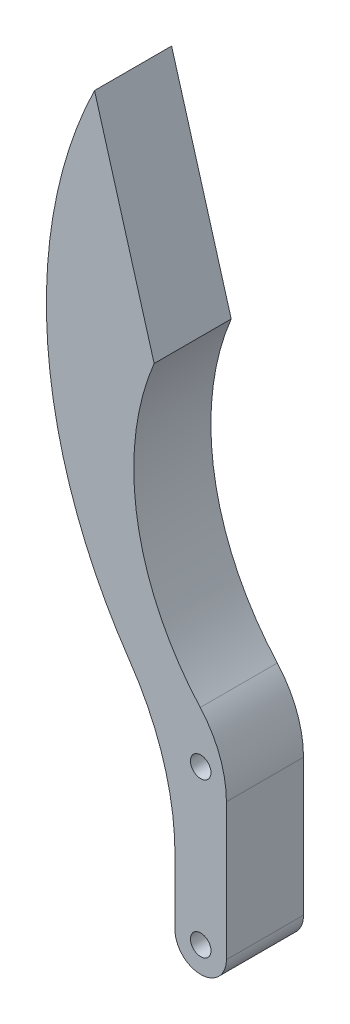
from build123d import *

# Parameters (mm, degrees)
BOSS_EXTRUDE1_DEPTH = 15
FILLET1_R           = 20
FILLET2_R           = 5
FILLET3_R           = 50


with BuildPart() as part:
    # Sketch1 → Boss-Extrude1 (new body)
    # profile 1 of 2: a face of its own
    with BuildSketch(Plane.XY):
        with BuildLine():
            Line((0, 0), (5, 0))
            Line((5, 0), (10, 0))
            Line((10, 0), (10, 40))
            ThreePointArc((10, 40), (-6.618184888, 66.911601725), (-4.062833515, 98.437282617))
            Line((-4.062833515, 98.437282617), (-12.996544728, 129.388331338))
            Line((-12.996544728, 129.388331338), (-15.666737168, 138.639274683))
            ThreePointArc((-15.666737168, 138.639274683), (-23.995534595, 84.376466953), (0, 35))
            Line((0, 35), (0, 25))
            Line((0, 25), (0, 0))
        make_face()
        with BuildLine():
            ThreePointArc((7, 5), (6.414213562, 3.585786438), (5, 3))
            ThreePointArc((5, 3), (3, 5), (5, 7))
            ThreePointArc((5, 7), (6.414213562, 6.414213562), (7, 5))
        make_face(mode=Mode.SUBTRACT)
        with BuildLine():
            ThreePointArc((7, 35), (6.414213562, 33.585786438), (5, 33))
            ThreePointArc((5, 33), (3, 35), (5, 37))
            ThreePointArc((5, 37), (6.414213562, 36.414213562), (7, 35))
        make_face(mode=Mode.SUBTRACT)
    # profile 2 of 2: a face of its own
    with BuildSketch(Plane.XY):
        with BuildLine():
            Line((0, 0), (5, 0))
            Line((5, 0), (10, 0))
            Line((10, 0), (10, 40))
            ThreePointArc((10, 40), (-6.618184888, 66.911601725), (-4.062833515, 98.437282617))
            Line((-4.062833515, 98.437282617), (-12.996544728, 129.388331338))
            Line((-12.996544728, 129.388331338), (-15.666737168, 138.639274683))
            ThreePointArc((-15.666737168, 138.639274683), (-23.995534595, 84.376466953), (0, 35))
            Line((0, 35), (0, 25))
            Line((0, 25), (0, 0))
        make_face()
        with BuildLine():
            ThreePointArc((7, 5), (6.414213562, 3.585786438), (5, 3))
            ThreePointArc((5, 3), (3, 5), (5, 7))
            ThreePointArc((5, 7), (6.414213562, 6.414213562), (7, 5))
        make_face(mode=Mode.SUBTRACT)
        with BuildLine():
            ThreePointArc((7, 35), (6.414213562, 33.585786438), (5, 33))
            ThreePointArc((5, 33), (3, 35), (5, 37))
            ThreePointArc((5, 37), (6.414213562, 36.414213562), (7, 35))
        make_face(mode=Mode.SUBTRACT)
    extrude(amount=BOSS_EXTRUDE1_DEPTH)

    # Fillet1
    fillet1_edges = [part.edges().sort_by_distance(p)[0] for p in [
        (10, 40, 7.5),
    ]]
    fillet(fillet1_edges, radius=FILLET1_R)

    # Fillet2
    fillet2_edges = [part.edges().sort_by_distance(p)[0] for p in [
        (0, 0, 7.5),
        (10, 0, 7.5),
    ]]
    fillet(fillet2_edges, radius=FILLET2_R - 0.0001)  # a hair under: the kernel refuses the full size

    # Fillet3
    fillet3_edges = [part.edges().sort_by_distance(p)[0] for p in [
        (0, 35, 7.5),
    ]]
    fillet(fillet3_edges, radius=FILLET3_R)


solid = part.part
